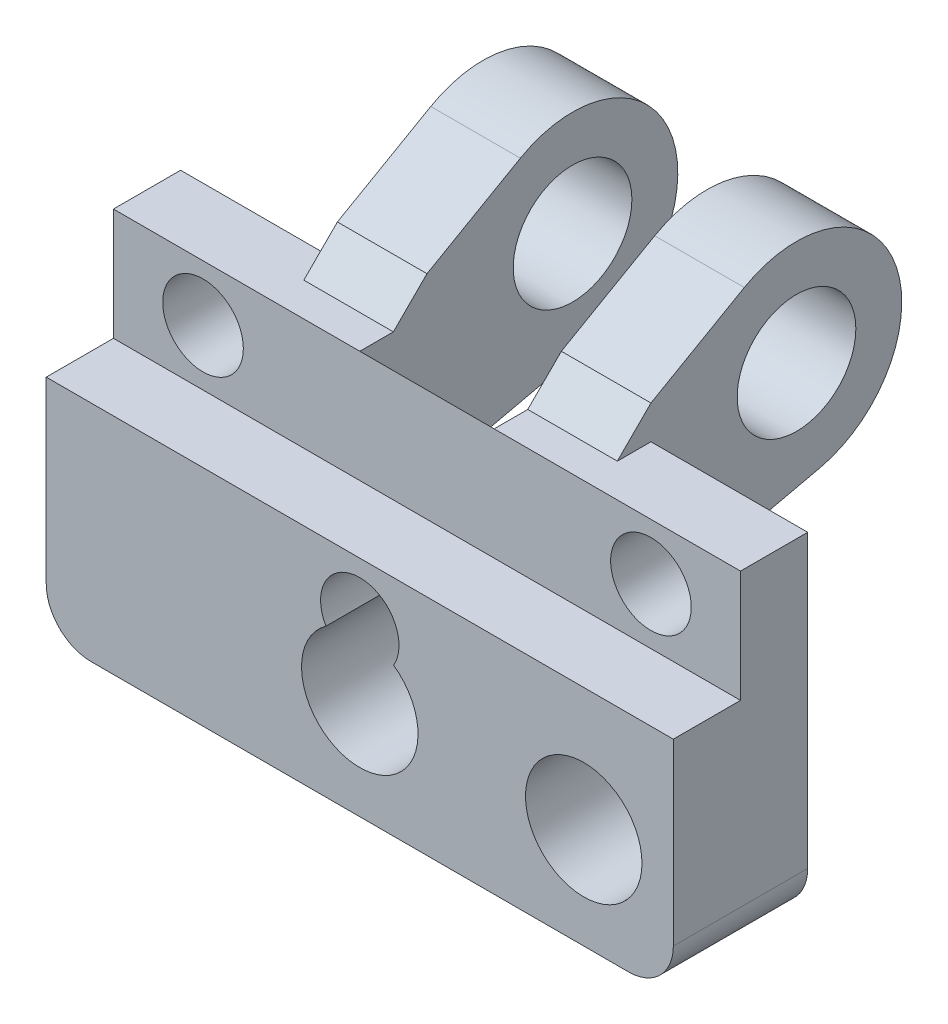
from build123d import *

# Parameters (mm, degrees)
SKETCH1_W           = 28
SKETCH1_H           = 5
BOSS_EXTRUDE1_DEPTH = 3
SKETCH1_3_W         = 28
SKETCH1_3_H         = 10
BOSS_EXTRUDE2_DEPTH = 6
SKETCH2_R           = 1.8
CUT_EXTRUDE1_DEPTH  = 20.006577809
SKETCH3_R           = 2.6
CUT_EXTRUDE2_DEPTH  = 20.704060495
SKETCH4_R           = 1.75
CUT_EXTRUDE3_DEPTH  = 20.704060495
SKETCH5_R           = 2.65
BOSS_EXTRUDE3_DEPTH = 7
SKETCH5_3_R         = 2.65
CUT_EXTRUDE5_DEPTH  = 3
CHAMFER1_SIZE       = 3
CHAMFER2_SIZE       = 1.5
FILLET1_R           = 2


with BuildPart() as part:
    # Sketch1 → Boss-Extrude1 (new body)
    with BuildSketch(Plane.XY):
        Rectangle(SKETCH1_W, SKETCH1_H)
    extrude(amount=BOSS_EXTRUDE1_DEPTH)

    # Sketch1<3> → Boss-Extrude2 (add)
    with BuildSketch(Plane.XY):
        with Locations((0, -7.5)):
            Rectangle(SKETCH1_3_W, SKETCH1_3_H)
    extrude(amount=BOSS_EXTRUDE2_DEPTH)

    # Sketch2 → Cut-Extrude1 (cut, through all)
    with BuildSketch(Plane.XY.offset(3)):
        with Locations((10, 0)):
            Circle(SKETCH2_R)
        with Locations((-10, 0)):
            Circle(SKETCH2_R)
    extrude(amount=-CUT_EXTRUDE1_DEPTH, mode=Mode.SUBTRACT)

    # Sketch3 → Cut-Extrude2 (cut, through all)
    with BuildSketch(Plane.XY.offset(6)):
        with Locations((10, -8)):
            Circle(SKETCH3_R)
        with Locations((0, -8)):
            Circle(SKETCH3_R)
    extrude(amount=-CUT_EXTRUDE2_DEPTH, mode=Mode.SUBTRACT)

    # Sketch4 → Cut-Extrude3 (cut, through all)
    with BuildSketch(Plane(origin=(0, 0, 0), x_dir=(-1, 0, 0), z_dir=(0, 0, -1))):
        with Locations((0, -5)):
            Circle(SKETCH4_R)
    extrude(amount=-CUT_EXTRUDE3_DEPTH, mode=Mode.SUBTRACT)

    # Sketch5 → Boss-Extrude3 (add, symmetric)
    with BuildSketch(Plane(origin=(0, 0, 0), x_dir=(0, 0, -1), z_dir=(1, 0, 0))):
        with BuildLine():
            Line((0, 4), (0, -4))
            Line((0, -4), (7.543277969, -2.282747111))
            ThreePointArc((7.543277969, -2.282747111), (10.879560122, 4.005711915), (4.168926053, 6.381187848))
            Line((4.168926053, 6.381187848), (0, 4))
        make_face()
        with Locations((6.5, 2.3)):
            Circle(SKETCH5_R, mode=Mode.SUBTRACT)
    extrude(amount=BOSS_EXTRUDE3_DEPTH, both=True)

    # Sketch5<3> → Cut-Extrude5 (cut, symmetric)
    with BuildSketch(Plane(origin=(0, 0, 0), x_dir=(0, 0, -1), z_dir=(1, 0, 0))):
        with BuildLine():
            Line((0, 4), (0, -4))
            Line((0, -4), (7.543277969, -2.282747111))
            ThreePointArc((7.543277969, -2.282747111), (10.879560122, 4.005711915), (4.168926053, 6.381187848))
            Line((4.168926053, 6.381187848), (0, 4))
        make_face()
        with Locations((6.5, 2.3)):
            Circle(SKETCH5_3_R, mode=Mode.SUBTRACT)
    extrude(amount=CUT_EXTRUDE5_DEPTH, both=True, mode=Mode.SUBTRACT)

    # Chamfer1
    chamfer1_edges = [part.edges().sort_by_distance(p)[0] for p in [
        (0, 2.5, 0),
    ]]
    chamfer(chamfer1_edges, length=CHAMFER1_SIZE - 0.0001)  # a hair under: the kernel refuses the full size

    # Chamfer2
    chamfer2_edges = [part.edges().sort_by_distance(p)[0] for p in [
        (-5, 2.5, 0),
        (5, 2.5, 0),
    ]]
    chamfer(chamfer2_edges, length=CHAMFER2_SIZE - 0.0001)  # a hair under: the kernel refuses the full size

    # Fillet1
    fillet1_edges = [part.edges().sort_by_distance(p)[0] for p in [
        (-14, -12.5, 3),
        (14, -12.5, 3),
        (5, -4, 0),
        (-5, -4, 0),
    ]]
    fillet(fillet1_edges, radius=FILLET1_R)


solid = part.part
